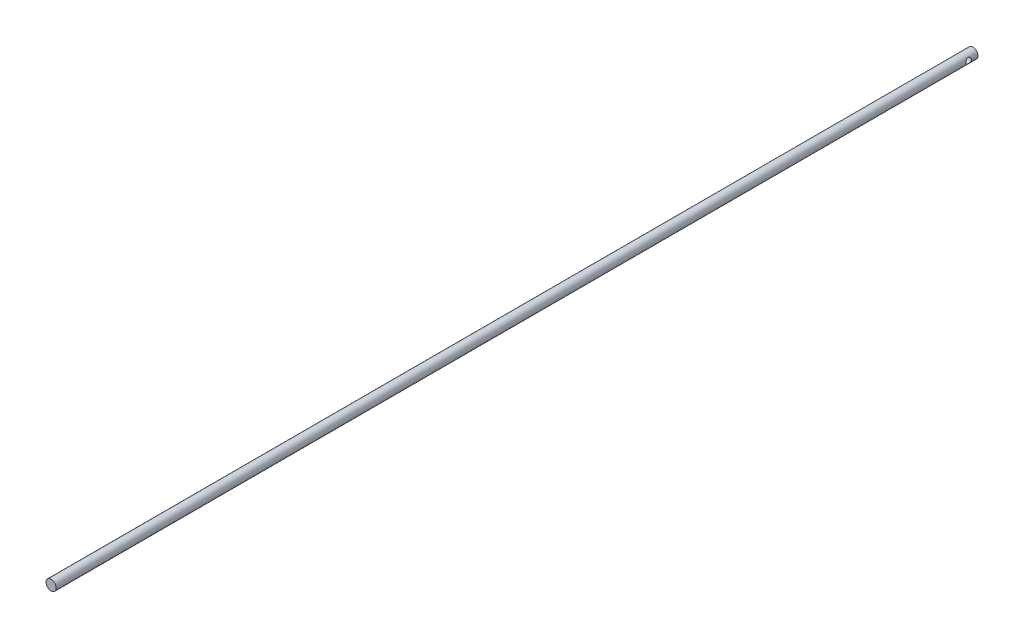
from build123d import *

# Parameters (mm, degrees)
SKETCH1_R              = 1.397
ROD_DEPTH              = 254
HOLE_REACH             = 256.008
SKETCH3_R              = 0.762
HOLE_DIRECTION_2_REACH = 256.008


with BuildPart() as part:
    # Sketch1 → Rod (new body)
    with BuildSketch(Plane.XY):
        Circle(SKETCH1_R)
    extrude(amount=ROD_DEPTH)

    # Sketch3 → Hole (cut, up to next)
    with BuildSketch(Plane(origin=(0, 0, 0), x_dir=(0, 0, -1), z_dir=(1, 0, 0)), mode=Mode.PRIVATE) as hole_sk1:
        with Locations((-2.54, 0)):
            Circle(SKETCH3_R)
    hole_tool1 = extrude(hole_sk1.sketch, amount=-HOLE_REACH, mode=Mode.PRIVATE) & part.part
    add(hole_tool1.solids().sort_by_distance((0, 0, 2.54))[0], mode=Mode.SUBTRACT)

    # Sketch3 → Hole direction 2 (cut, up to next)
    with BuildSketch(Plane(origin=(0, 0, 0), x_dir=(0, 0, -1), z_dir=(1, 0, 0)), mode=Mode.PRIVATE) as hole_direction_2_sk1:
        with Locations((-2.54, 0)):
            Circle(SKETCH3_R)
    hole_direction_2_tool1 = extrude(hole_direction_2_sk1.sketch, amount=HOLE_DIRECTION_2_REACH, mode=Mode.PRIVATE) & part.part
    add(hole_direction_2_tool1.solids().sort_by_distance((0, 0, 2.54))[0], mode=Mode.SUBTRACT)


solid = part.part
